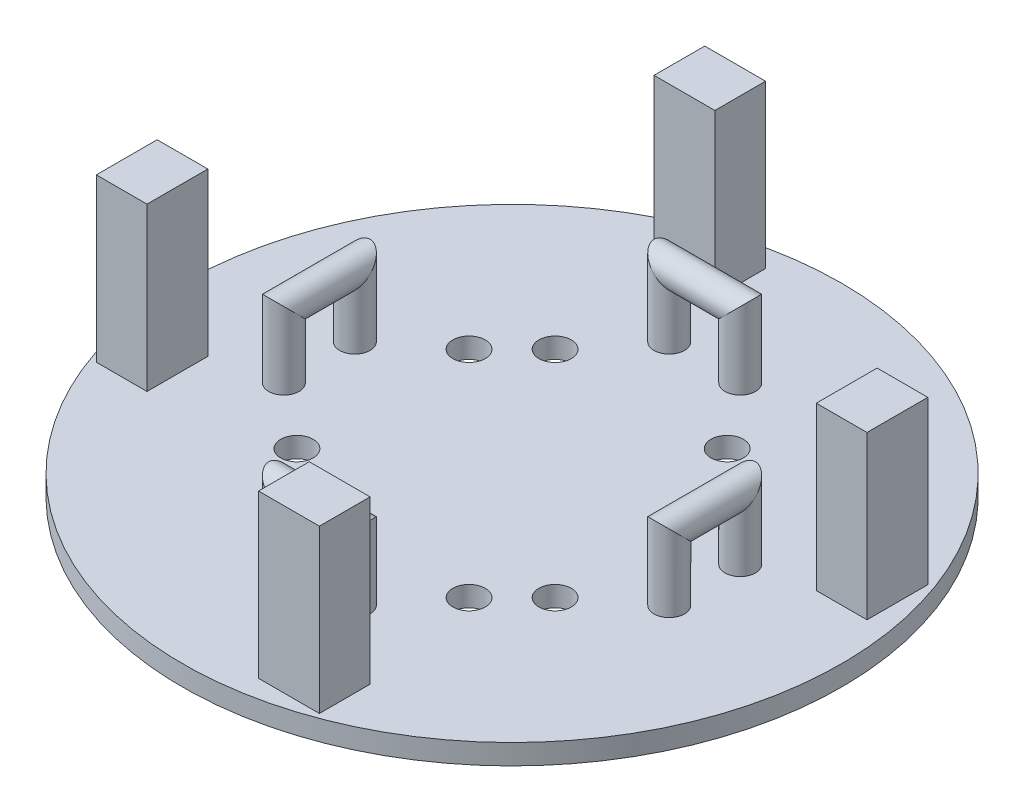
from build123d import *

# Parameters (mm, degrees)
EXTRUDE_1_REACH          = 10.5
SKETCH_2_R               = 1.5
EXTRUDE_2_REACH          = 9.228
SKETCH_3_R               = 1.5
EXTRUDE_START            = 3
SKETCH_4_R               = 1.5
EXTRUDE_3_DEPTH          = 3
SKETCH_5_R               = 32.5
EXTRUDE_4_DEPTH          = 2
PATTERN_CIRCULAR_2_COUNT = 4
SKETCH_6_W               = 5
SKETCH_6_H               = 6
EXTRUDE_5_DEPTH          = 16
PATTERN_CIRCULAR_3_COUNT = 4
SKETCH_7_R               = 1.6
CUT_EXTRUDE_1_DEPTH      = 63.964275585
PATTERN_CIRCULAR_4_COUNT = 4


with BuildPart() as part:
    # ﾎﾞｽ - 押し出し1: up to this plane
    extrude_1_end = Plane(origin=(0, 0, 0), z_dir=(-0.7071067811865475, 0.7071067811865477, 0))
    # ｽｹｯﾁ2 → ﾎﾞｽ - 押し出し1 (new, up to the surface)
    with BuildSketch(Plane(origin=(0, 0, 0), x_dir=(1, 0, 0), z_dir=(0, 1, 0)), mode=Mode.PRIVATE) as extrude_1_sk1:
        with Locations((3.5, 0)):
            Circle(SKETCH_2_R)
    extrude_1_tool1 = split(extrude(extrude_1_sk1.sketch, amount=EXTRUDE_1_REACH, mode=Mode.PRIVATE), bisect_by=extrude_1_end, keep=Keep.BOTH, mode=Mode.PRIVATE)
    add(extrude_1_tool1.solids().sort_by_distance((3.5, 0, 0))[0])

    # ｽｹｯﾁ3 → ﾎﾞｽ - 押し出し2 (add, up to next)
    with BuildSketch(Plane(origin=(0, 0, 0), x_dir=(0, 0, -1), z_dir=(1, 0, 0)), mode=Mode.PRIVATE) as extrude_2_sk1:
        with Locations((0, 3.5)):
            Circle(SKETCH_3_R)
    extrude_2_tool1 = extrude(extrude_2_sk1.sketch, amount=EXTRUDE_2_REACH, mode=Mode.PRIVATE) - part.part
    add(extrude_2_tool1.solids().sort_by_distance((0, 3.5, 0))[0])

    # ﾐﾗｰ2: part across plane


with BuildPart() as part_1:
    add(part.part)
    add(part.part.mirror(Plane(origin=(0, 0, 0), x_dir=(0, 0, 1), z_dir=(1, 0, 0))))

    # ｽｹｯﾁ4 → ﾎﾞｽ - 押し出し3 (add)
    with BuildSketch(Plane.XZ.offset(EXTRUDE_START)):
        with Locations((3.5, 0)):
            Circle(SKETCH_4_R)
        with Locations((-3.5, 0)):
            Circle(SKETCH_4_R)
    extrude(amount=-EXTRUDE_3_DEPTH)

    # ｽｹｯﾁ5 → ﾎﾞｽ - 押し出し4 (add)
    with BuildSketch(Plane.XZ.offset(3)):
        with Locations((0, -19)):
            Circle(SKETCH_5_R)
    extrude(amount=EXTRUDE_4_DEPTH)


with BuildPart() as pattern_circular_2_1:
    # 円形ﾊﾟﾀｰﾝ2: pattern copy
    add(part_1.part.rotate(Axis((0, -5, -19), (0, 1, 0)), 1 * 360 / PATTERN_CIRCULAR_2_COUNT))


with BuildPart() as pattern_circular_2_2:
    # 円形ﾊﾟﾀｰﾝ2: pattern copy
    add(part_1.part.rotate(Axis((0, -5, -19), (0, 1, 0)), 2 * 360 / PATTERN_CIRCULAR_2_COUNT))


with BuildPart() as pattern_circular_2_3:
    # 円形ﾊﾟﾀｰﾝ2: pattern copy
    add(part_1.part.rotate(Axis((0, -5, -19), (0, 1, 0)), 3 * 360 / PATTERN_CIRCULAR_2_COUNT))


with BuildPart() as part_2:
    add(part_1.part)

    add(pattern_circular_2_1.part)  # ﾎﾞｽ - 押し出し5 merges 円形ﾊﾟﾀｰﾝ2_1

    add(pattern_circular_2_2.part)  # ﾎﾞｽ - 押し出し5 merges 円形ﾊﾟﾀｰﾝ2_2

    add(pattern_circular_2_3.part)  # ﾎﾞｽ - 押し出し5 merges 円形ﾊﾟﾀｰﾝ2_3
    # ｽｹｯﾁ6 → ﾎﾞｽ - 押し出し5 (add)
    with BuildSketch(Plane(origin=(0, -3, 0), x_dir=(1, 0, 0), z_dir=(0, 1, 0))):
        with Locations((27.5, 27)):
            Rectangle(SKETCH_6_W, SKETCH_6_H)
    extrude_5 = extrude(amount=EXTRUDE_5_DEPTH)

    # 円形ﾊﾟﾀｰﾝ3: ﾎﾞｽ - 押し出し5 ×4 about axis
    pattern_circular_3_axis = Axis((0, -3, -19), (0, -1, 0))
    for i in range(1, PATTERN_CIRCULAR_3_COUNT):
        add(extrude_5.rotate(pattern_circular_3_axis, i * 360 / PATTERN_CIRCULAR_3_COUNT))

    # ｽｹｯﾁ7 → ｶｯﾄ - 押し出し1 (cut, through all)
    with BuildSketch(Plane(origin=(0, -3, 0), x_dir=(1, 0, 0), z_dir=(0, 1, 0))):
        with Locations((-8.485281374, 6.272077939)):
            Circle(SKETCH_7_R)
        with Locations((-12.727922061, 10.514718626)):
            Circle(SKETCH_7_R)
    cut_extrude_1 = extrude(amount=-CUT_EXTRUDE_1_DEPTH, mode=Mode.SUBTRACT)

    # 円形ﾊﾟﾀｰﾝ4: ｶｯﾄ - 押し出し1 ×4 about axis
    pattern_circular_4_axis = Axis((0, -3, -19), (0, -1, 0))
    for i in range(1, PATTERN_CIRCULAR_4_COUNT):
        add(cut_extrude_1.rotate(pattern_circular_4_axis, i * 360 / PATTERN_CIRCULAR_4_COUNT), mode=Mode.SUBTRACT)


solid = part_2.part
